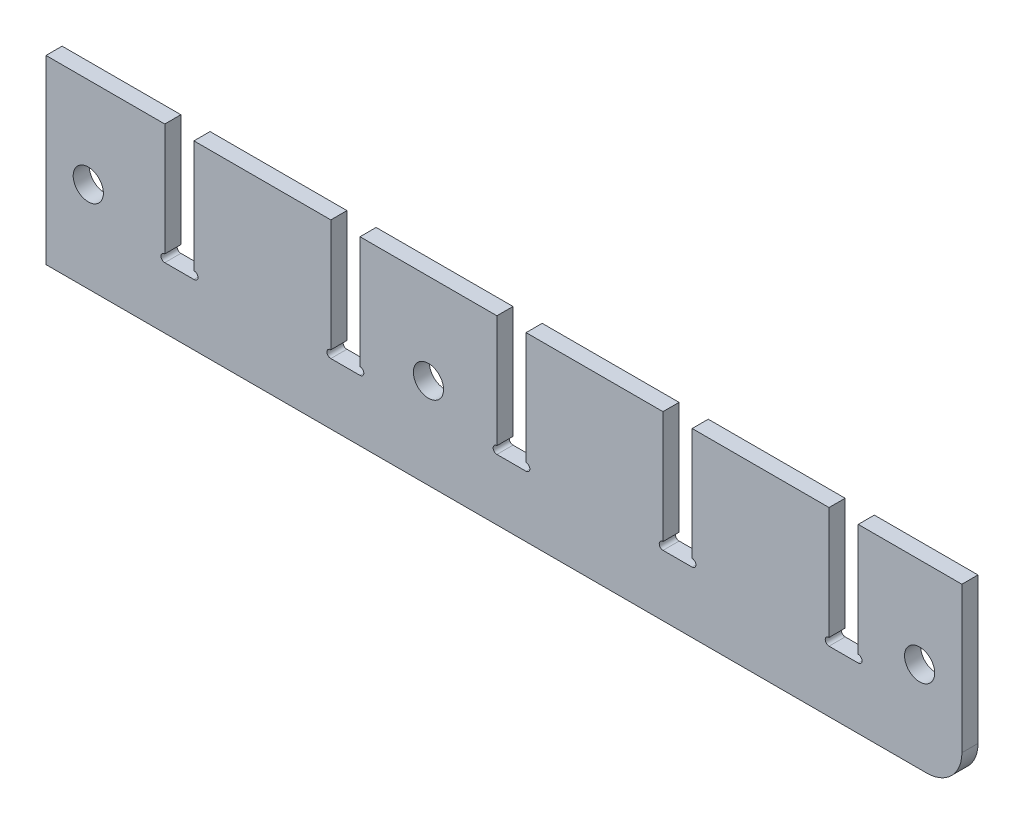
from build123d import *

# Parameters (mm, degrees)
SZKIC1_W                    = 91
SZKIC1_H                    = 18
DODANIE_WYCI_GNI_CIE1_DEPTH = 1.6
GNIAZDO1_START              = 14.181534091
GNIAZDO1_OUTLINE_W          = 1.6
GNIAZDO1_OUTLINE_H          = 1.6
GNIAZDO1_OUTLINE_W_2        = 2.8
GNIAZDO1_DEPTH              = 8.199061552
GNIAZDO1_START_2            = 23.132472539
GNIAZDO1_2_OUTLINE_W        = 1.6
GNIAZDO1_2_OUTLINE_H        = 1.598549721
GNIAZDO1_2_DEPTH            = 1.849061552
GNIAZDO1_START_3            = 14.151534091
GNIAZDO1_3_OUTLINE_W        = 1.2
GNIAZDO1_3_OUTLINE_H        = 1.6
GNIAZDO1_3_DEPTH            = 8.25
GNIAZDO1_START_4            = 20.480374091
GNIAZDO1_4_OUTLINE_W        = 1.6
GNIAZDO1_4_OUTLINE_H        = 0.001450279
GNIAZDO1_4_DEPTH            = 1.90116
GNIAZDO1_START_5            = -17.405681818
GNIAZDO1_5_DEPTH            = 1.6
GNIAZDO1_START_6            = -0.905681818
GNIAZDO1_6_DEPTH            = 1.6
GNIAZDO1_START_7            = 15.594318182
GNIAZDO1_7_DEPTH            = 1.6
GNIAZDO1_START_8            = 32.094318182
GNIAZDO1_8_DEPTH            = 1.6
GNIAZDO1_START_9            = 48.594318182
GNIAZDO1_9_DEPTH            = 1.6
GNIAZDO2_START              = 14.151534091
GNIAZDO2_OUTLINE_W          = 1.2
GNIAZDO2_OUTLINE_H          = 1.6
GNIAZDO2_DEPTH              = 8.25
SZKIC4_W                    = 2.7
SZKIC4_H                    = 11.83
WYTNIJ_WYCI_GNI_CIE1_DEPTH  = 1.6
ZAOKR_GLENIE1_R             = 3.5
SZKIC5_W                    = 2.9
SZKIC5_H                    = 11.93
WYTNIJ_WYCI_GNI_CIE2_DEPTH  = 1.6
SZKIC6_R                    = 1.5
WYTNIJ_WYCI_GNI_CIE5_DEPTH  = 1.6
SZKIC7_R                    = 1.5
WYTNIJ_WYCI_GNI_CIE4_DEPTH  = 66.857138155
SZKIC8_R                    = 0.375
SZKIC8_R_2                  = 0.375807067
SZKIC8_R_3                  = 0.375017675
SZKIC8_R_4                  = 0.375009396
WYTNIJ_WYCI_GNI_CIE6_DEPTH  = 1.6


with BuildPart() as part:
    # Szkic1 → Dodanie-wyciągnięcie1 (new body)
    with BuildSketch(Plane.XY):
        with Locations((14.994318182, 16.981534091)):
            Rectangle(SZKIC1_W, SZKIC1_H)
    extrude(amount=DODANIE_WYCI_GNI_CIE1_DEPTH)

    # Gniazdo1: read off the stored shape, not the designer's step
    # Gniazdo1 outline → Gniazdo1 (cut)
    with BuildSketch(Plane(origin=(0, 0, 0), x_dir=(1, 0, 0), z_dir=(0, 1, 0)).offset(GNIAZDO1_START)):
        with Locations((-16.605681818, -0.8)):
            Rectangle(GNIAZDO1_OUTLINE_W, GNIAZDO1_OUTLINE_H)
        with Locations((-0.705681818, -0.8)):
            Rectangle(GNIAZDO1_OUTLINE_W_2, GNIAZDO1_OUTLINE_H)
        with Locations((15.794318182, -0.8)):
            Rectangle(GNIAZDO1_OUTLINE_W_2, GNIAZDO1_OUTLINE_H)
        with Locations((32.294318182, -0.8)):
            Rectangle(GNIAZDO1_OUTLINE_W_2, GNIAZDO1_OUTLINE_H)
        with Locations((48.794318182, -0.8)):
            Rectangle(GNIAZDO1_OUTLINE_W_2, GNIAZDO1_OUTLINE_H)
    extrude(amount=GNIAZDO1_DEPTH, mode=Mode.SUBTRACT)

    # Gniazdo1 2 outline → Gniazdo1 2 (cut)
    with BuildSketch(Plane(origin=(0, 0, 0), x_dir=(1, 0, 0), z_dir=(0, 1, 0)).offset(GNIAZDO1_START_2)):
        with Locations((-16.605681818, -0.799274861)):
            Rectangle(GNIAZDO1_2_OUTLINE_W, GNIAZDO1_2_OUTLINE_H)
        with Locations((-0.105681818, -0.799274861)):
            Rectangle(GNIAZDO1_2_OUTLINE_W, GNIAZDO1_2_OUTLINE_H)
        with Locations((16.394318182, -0.799274861)):
            Rectangle(GNIAZDO1_2_OUTLINE_W, GNIAZDO1_2_OUTLINE_H)
        with Locations((32.894318182, -0.799274861)):
            Rectangle(GNIAZDO1_2_OUTLINE_W, GNIAZDO1_2_OUTLINE_H)
        with Locations((49.394318182, -0.799274861)):
            Rectangle(GNIAZDO1_2_OUTLINE_W, GNIAZDO1_2_OUTLINE_H)
    extrude(amount=GNIAZDO1_2_DEPTH, mode=Mode.SUBTRACT)

    # Gniazdo1 3 outline → Gniazdo1 3 (cut)
    with BuildSketch(Plane(origin=(0, 0, 0), x_dir=(1, 0, 0), z_dir=(0, 1, 0)).offset(GNIAZDO1_START_3)):
        with Locations((-1.505681818, -0.8)):
            Rectangle(GNIAZDO1_3_OUTLINE_W, GNIAZDO1_3_OUTLINE_H)
        with Locations((14.994318182, -0.8)):
            Rectangle(GNIAZDO1_3_OUTLINE_W, GNIAZDO1_3_OUTLINE_H)
        with Locations((31.494318182, -0.8)):
            Rectangle(GNIAZDO1_3_OUTLINE_W, GNIAZDO1_3_OUTLINE_H)
        with Locations((47.994318182, -0.8)):
            Rectangle(GNIAZDO1_3_OUTLINE_W, GNIAZDO1_3_OUTLINE_H)
    extrude(amount=GNIAZDO1_3_DEPTH, mode=Mode.SUBTRACT)

    # Gniazdo1 4 outline → Gniazdo1 4 (cut)
    with BuildSketch(Plane(origin=(0, 0, 0), x_dir=(1, 0, 0), z_dir=(0, 1, 0)).offset(GNIAZDO1_START_4)):
        with Locations((-16.605681818, -1.599274861)):
            Rectangle(GNIAZDO1_4_OUTLINE_W, GNIAZDO1_4_OUTLINE_H)
        with Locations((-0.105681818, -1.599274861)):
            Rectangle(GNIAZDO1_4_OUTLINE_W, GNIAZDO1_4_OUTLINE_H)
        with Locations((16.394318182, -1.599274861)):
            Rectangle(GNIAZDO1_4_OUTLINE_W, GNIAZDO1_4_OUTLINE_H)
        with Locations((32.894318182, -1.599274861)):
            Rectangle(GNIAZDO1_4_OUTLINE_W, GNIAZDO1_4_OUTLINE_H)
        with Locations((49.394318182, -1.599274861)):
            Rectangle(GNIAZDO1_4_OUTLINE_W, GNIAZDO1_4_OUTLINE_H)
    extrude(amount=GNIAZDO1_4_DEPTH, mode=Mode.SUBTRACT)

    # Gniazdo1 5 outline → Gniazdo1 5 (cut)
    with BuildSketch(Plane.YZ.offset(GNIAZDO1_START_5)):
        with BuildLine():
            Line((23.132472539, 1.598549721), (23.131534091, 1.598549721))
            ThreePointArc((23.131534091, 1.598549721), (23.132237853, 1.585284765), (23.132472539, 1.572003227))
            Line((23.132472539, 1.572003227), (23.132472539, 1.598549721))
        make_face()
        with BuildLine():
            Line((22.380595643, 1.598549721), (22.380595643, 1.572003227))
            ThreePointArc((22.380595643, 1.572003227), (22.380830329, 1.585284765), (22.381534091, 1.598549721))
            Line((22.381534091, 1.598549721), (22.380595643, 1.598549721))
        make_face()
        with BuildLine():
            Line((23.132472539, 0), (23.132472539, 1.572003227))
            ThreePointArc((23.132472539, 1.572003227), (22.756534091, 1.196064779), (22.380595643, 1.572003227))
            Line((22.380595643, 1.572003227), (22.380595643, 0))
            Line((22.380595643, 0), (23.132472539, 0))
        make_face()
    extrude(amount=GNIAZDO1_5_DEPTH, mode=Mode.SUBTRACT)

    # Gniazdo1 6 outline → Gniazdo1 6 (cut)
    with BuildSketch(Plane.YZ.offset(GNIAZDO1_START_6)):
        with BuildLine():
            Line((23.132472539, 1.598549721), (23.131534091, 1.598549721))
            ThreePointArc((23.131534091, 1.598549721), (23.132237853, 1.585284765), (23.132472539, 1.572003227))
            Line((23.132472539, 1.572003227), (23.132472539, 1.598549721))
        make_face()
        with BuildLine():
            Line((22.380595643, 1.598549721), (22.380595643, 1.572003227))
            ThreePointArc((22.380595643, 1.572003227), (22.380830329, 1.585284765), (22.381534091, 1.598549721))
            Line((22.381534091, 1.598549721), (22.380595643, 1.598549721))
        make_face()
        with BuildLine():
            Line((23.132472539, 0), (23.132472539, 1.572003227))
            ThreePointArc((23.132472539, 1.572003227), (22.756534091, 1.196064779), (22.380595643, 1.572003227))
            Line((22.380595643, 1.572003227), (22.380595643, 0))
            Line((22.380595643, 0), (23.132472539, 0))
        make_face()
    extrude(amount=GNIAZDO1_6_DEPTH, mode=Mode.SUBTRACT)

    # Gniazdo1 7 outline → Gniazdo1 7 (cut)
    with BuildSketch(Plane.YZ.offset(GNIAZDO1_START_7)):
        with BuildLine():
            Line((23.132472539, 1.598549721), (23.131534091, 1.598549721))
            ThreePointArc((23.131534091, 1.598549721), (23.132237853, 1.585284765), (23.132472539, 1.572003227))
            Line((23.132472539, 1.572003227), (23.132472539, 1.598549721))
        make_face()
        with BuildLine():
            Line((22.380595643, 1.598549721), (22.380595643, 1.572003227))
            ThreePointArc((22.380595643, 1.572003227), (22.380830329, 1.585284765), (22.381534091, 1.598549721))
            Line((22.381534091, 1.598549721), (22.380595643, 1.598549721))
        make_face()
        with BuildLine():
            Line((23.132472539, 0), (23.132472539, 1.572003227))
            ThreePointArc((23.132472539, 1.572003227), (22.756534091, 1.196064779), (22.380595643, 1.572003227))
            Line((22.380595643, 1.572003227), (22.380595643, 0))
            Line((22.380595643, 0), (23.132472539, 0))
        make_face()
    extrude(amount=GNIAZDO1_7_DEPTH, mode=Mode.SUBTRACT)

    # Gniazdo1 8 outline → Gniazdo1 8 (cut)
    with BuildSketch(Plane.YZ.offset(GNIAZDO1_START_8)):
        with BuildLine():
            Line((23.132472539, 1.598549721), (23.131534091, 1.598549721))
            ThreePointArc((23.131534091, 1.598549721), (23.132237853, 1.585284765), (23.132472539, 1.572003227))
            Line((23.132472539, 1.572003227), (23.132472539, 1.598549721))
        make_face()
        with BuildLine():
            Line((22.380595643, 1.598549721), (22.380595643, 1.572003227))
            ThreePointArc((22.380595643, 1.572003227), (22.380830329, 1.585284765), (22.381534091, 1.598549721))
            Line((22.381534091, 1.598549721), (22.380595643, 1.598549721))
        make_face()
        with BuildLine():
            Line((23.132472539, 0), (23.132472539, 1.572003227))
            ThreePointArc((23.132472539, 1.572003227), (22.756534091, 1.196064779), (22.380595643, 1.572003227))
            Line((22.380595643, 1.572003227), (22.380595643, 0))
            Line((22.380595643, 0), (23.132472539, 0))
        make_face()
    extrude(amount=GNIAZDO1_8_DEPTH, mode=Mode.SUBTRACT)

    # Gniazdo1 9 outline → Gniazdo1 9 (cut)
    with BuildSketch(Plane.YZ.offset(GNIAZDO1_START_9)):
        with BuildLine():
            Line((23.132472539, 1.598549721), (23.131534091, 1.598549721))
            ThreePointArc((23.131534091, 1.598549721), (23.132237853, 1.585284765), (23.132472539, 1.572003227))
            Line((23.132472539, 1.572003227), (23.132472539, 1.598549721))
        make_face()
        with BuildLine():
            Line((22.380595643, 1.598549721), (22.380595643, 1.572003227))
            ThreePointArc((22.380595643, 1.572003227), (22.380830329, 1.585284765), (22.381534091, 1.598549721))
            Line((22.381534091, 1.598549721), (22.380595643, 1.598549721))
        make_face()
        with BuildLine():
            Line((23.132472539, 0), (23.132472539, 1.572003227))
            ThreePointArc((23.132472539, 1.572003227), (22.756534091, 1.196064779), (22.380595643, 1.572003227))
            Line((22.380595643, 1.572003227), (22.380595643, 0))
            Line((22.380595643, 0), (23.132472539, 0))
        make_face()
    extrude(amount=GNIAZDO1_9_DEPTH, mode=Mode.SUBTRACT)

    # Gniazdo2: read off the stored shape, not the designer's step
    # Gniazdo2 outline → Gniazdo2 (cut)
    with BuildSketch(Plane(origin=(0, 0, 0), x_dir=(1, 0, 0), z_dir=(0, 1, 0)).offset(GNIAZDO2_START)):
        with Locations((-18.005681818, -0.8)):
            Rectangle(GNIAZDO2_OUTLINE_W, GNIAZDO2_OUTLINE_H)
    extrude(amount=GNIAZDO2_DEPTH, mode=Mode.SUBTRACT)

    # Szkic4 → Wytnij-wyciągnięcie1 (cut)
    with BuildSketch(Plane.XY.offset(1.6)):
        with Locations((-17.255681818, 20.066534091)):
            Rectangle(SZKIC4_W, SZKIC4_H)
        with Locations((-0.755681818, 20.066534091)):
            Rectangle(SZKIC4_W, SZKIC4_H)
        with Locations((15.744318182, 20.066534091)):
            Rectangle(SZKIC4_W, SZKIC4_H)
        with Locations((32.244318182, 20.066534091)):
            Rectangle(SZKIC4_W, SZKIC4_H)
        with Locations((48.744318182, 20.066534091)):
            Rectangle(SZKIC4_W, SZKIC4_H)
    extrude(amount=-WYTNIJ_WYCI_GNI_CIE1_DEPTH, mode=Mode.SUBTRACT)

    # Zaokrąglenie1
    zaokr_glenie1_edges = [part.edges().sort_by_distance(p)[0] for p in [
        (60.494318182, 7.981534091, 0.8),
    ]]
    fillet(zaokr_glenie1_edges, radius=ZAOKR_GLENIE1_R)

    # Szkic5 → Wytnij-wyciągnięcie2 (cut)
    with BuildSketch(Plane.XY.offset(1.6)):
        with Locations((48.744318182, 20.016534091)):
            Rectangle(SZKIC5_W, SZKIC5_H)
        with Locations((32.244318182, 20.016534091)):
            Rectangle(SZKIC5_W, SZKIC5_H)
        with Locations((15.744318182, 20.016534091)):
            Rectangle(SZKIC5_W, SZKIC5_H)
        with Locations((-0.755681818, 20.016534091)):
            Rectangle(SZKIC5_W, SZKIC5_H)
        with Locations((-17.255681818, 20.016534091)):
            Rectangle(SZKIC5_W, SZKIC5_H)
    extrude(amount=-WYTNIJ_WYCI_GNI_CIE2_DEPTH, mode=Mode.SUBTRACT)

    # Szkic6 → Wytnij-wyciągnięcie5 (cut)
    with BuildSketch(Plane.XY.offset(1.6)):
        with Locations((56.294318182, 16.981534091)):
            Circle(SZKIC6_R)
        with Locations((-26.305681818, 16.981534091)):
            Circle(SZKIC6_R)
    extrude(amount=-WYTNIJ_WYCI_GNI_CIE5_DEPTH, mode=Mode.SUBTRACT)

    # Szkic7 → Wytnij-wyciągnięcie4 (cut, through all)
    with BuildSketch(Plane.XY.offset(1.6)):
        with Locations((7.494318182, 16.981534091)):
            Circle(SZKIC7_R)
    extrude(amount=-WYTNIJ_WYCI_GNI_CIE4_DEPTH, mode=Mode.SUBTRACT)

    # Szkic8 → Wytnij-wyciągnięcie6 (cut)
    with BuildSketch(Plane(origin=(0, 0, 0), x_dir=(-1, 0, 0), z_dir=(0, 0, -1))):
        with Locations((18.705681818, 14.426534091)):
            Circle(SZKIC8_R)
        with Locations((15.781065738, 14.426534091)):
            Circle(SZKIC8_R_2)
        with Locations((2.217363992, 14.426534091)):
            Circle(SZKIC8_R)
        with Locations((-0.694318182, 14.426534091)):
            Circle(SZKIC8_R)
        with Locations((-14.292270167, 14.426534091)):
            Circle(SZKIC8_R)
        with Locations((-17.190750174, 14.426534091)):
            Circle(SZKIC8_R)
        with Locations((-30.797959124, 14.426534091)):
            Circle(SZKIC8_R_3)
        with Locations((-33.694318182, 14.426534091)):
            Circle(SZKIC8_R)
        with Locations((-47.291663502, 14.426534091)):
            Circle(SZKIC8_R_4)
        with Locations((-50.194318182, 14.426534091)):
            Circle(SZKIC8_R)
    extrude(amount=-WYTNIJ_WYCI_GNI_CIE6_DEPTH, mode=Mode.SUBTRACT)


solid = part.part
